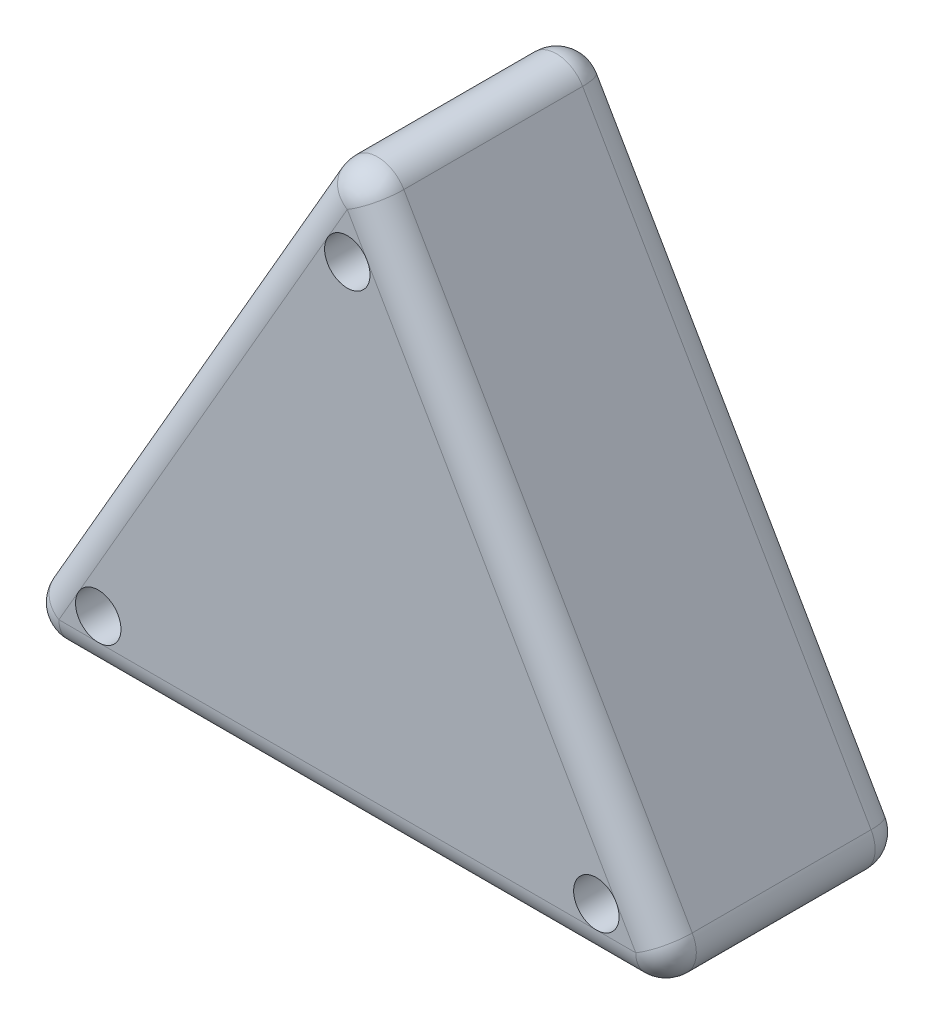
from build123d import *

# Parameters (mm, degrees)
ESQUISSE1_R             = 1.5
BOSS_EXTRU_1_DEPTH      = 15.8
ESQUISSE2_R             = 9.01
ENL_V_MAT_EXTRU_1_DEPTH = 9.8
CHANFREIN1_SIZE         = 1
CONG_2_R                = 2


with BuildPart() as part:
    # Esquisse1 → Boss.-Extru.1 (new body)
    with BuildSketch(Plane.XY):
        with BuildLine():
            Line((1.732050808, 3), (20.767949192, 35.97114317))
            ThreePointArc((20.767949192, 35.97114317), (22.5, 36.97114317), (24.232050808, 35.97114317))
            Line((24.232050808, 35.97114317), (43.267949192, 3))
            ThreePointArc((43.267949192, 3), (43.267949192, 1), (41.535898385, 0))
            Line((41.535898385, 0), (3.464101615, 0))
            ThreePointArc((3.464101615, 0), (1.732050808, 1), (1.732050808, 3))
        make_face()
        with Locations((22.5, 31.97114317)):
            Circle(ESQUISSE1_R, mode=Mode.SUBTRACT)
        with Locations((38.937822174, 3.5)):
            Circle(ESQUISSE1_R, mode=Mode.SUBTRACT)
        with Locations(Location((6.062177826, 3.5, 0), (0, 0, 180))):
            Circle(ESQUISSE1_R, mode=Mode.SUBTRACT)
    extrude(amount=BOSS_EXTRU_1_DEPTH)

    # Esquisse2 → Enlèv. mat.-Extru.1 (cut)
    with BuildSketch(Plane(origin=(0, 0, 0), x_dir=(-1, 0, 0), z_dir=(0, 0, -1))):
        with Locations((-22.5, 12.990381057)):
            Circle(ESQUISSE2_R)
    extrude(amount=-ENL_V_MAT_EXTRU_1_DEPTH, mode=Mode.SUBTRACT)

    # Chanfrein1
    chanfrein1_edges = [part.edges().sort_by_distance(p)[0] for p in [
        (31.51, 12.990381057, 0),
    ]]
    chamfer(chanfrein1_edges, length=CHANFREIN1_SIZE)

    # Congé2
    cong_2_edges = [part.edges().sort_by_distance(p)[0] for p in [
        (43.267949192, 1, 15.8),
        (22.5, 0, 15.8),
        (1.732050808, 1, 15.8),
        (11.25, 19.485571585, 15.8),
        (22.5, 36.97114317, 15.8),
        (11.25, 19.485571585, 0),
        (1.732050808, 1, 0),
        (22.5, 0, 0),
        (43.267949192, 1, 0),
        (33.75, 19.485571585, 0),
        (22.5, 36.97114317, 0),
        (33.75, 19.485571585, 15.8),
    ]]
    fillet(cong_2_edges, radius=CONG_2_R - 0.0001)  # a hair under: the kernel refuses the full size


solid = part.part
